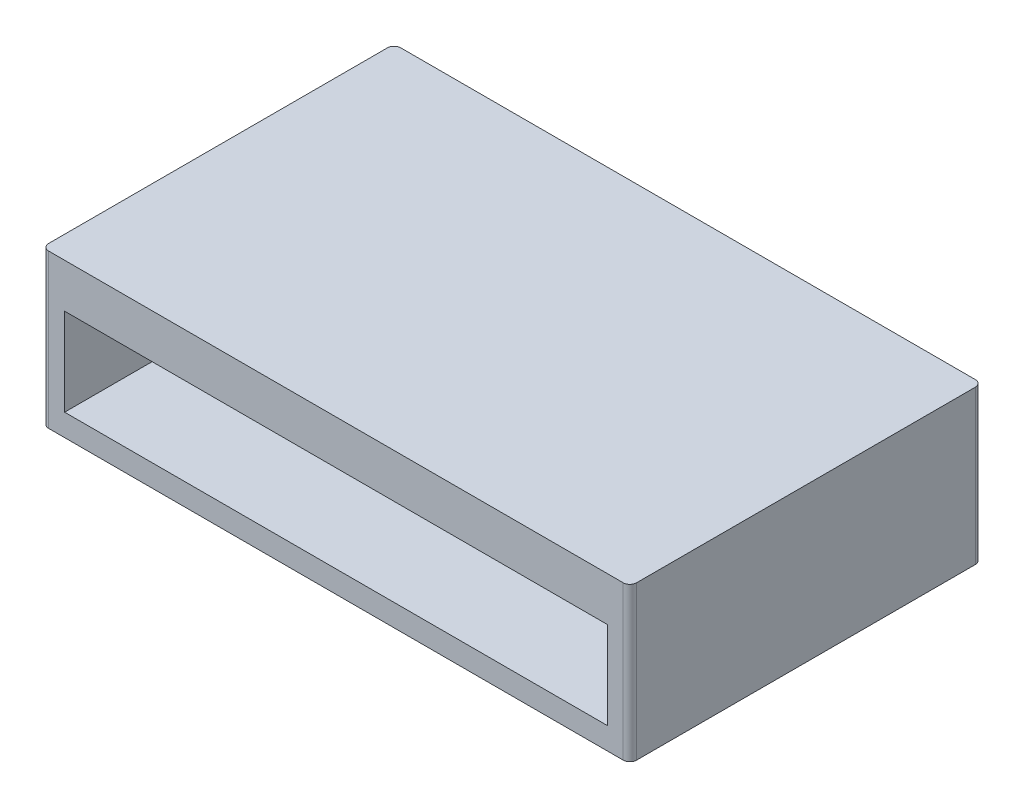
from build123d import *

# Parameters (mm, degrees)
SKETCH1_W                        = 88
SKETCH1_H                        = 52.7
BOSS_EXTRUDE1_DEPTH              = 23
SKETCH2_W                        = 81.25
SKETCH2_H                        = 13.1
CUT_EXTRUDE1_DEPTH               = 15.75
CUT_EXTRUDE2_DEPTH               = 6.5
SKETCH4_W                        = 6.69
SKETCH4_H                        = 0.8
BOSS_EXTRUDE2_DEPTH              = 6
FILLET1_R                        = 1
SKETCH6_W                        = 1.5
SKETCH6_H                        = 9
BOSS_EXTRUDE3_DEPTH              = 1
CHAMFER1_SIZE                    = 1
CHAMFER1_OF_SKETCH_PATTERN1_SIZE = 1
CUT_EXTRUDE3_DEPTH               = 4
CUT_EXTRUDE4_START               = -1.5
CUT_EXTRUDE4_DEPTH               = 2.5


with BuildPart() as part:
    # Sketch1 → Boss-Extrude1 (new body)
    with BuildSketch(Plane(origin=(0, 0, 0), x_dir=(1, 0, 0), z_dir=(0, 1, 0))):
        with Locations((44, 26.35)):
            Rectangle(SKETCH1_W, SKETCH1_H)
    extrude(amount=BOSS_EXTRUDE1_DEPTH)

    # Sketch2 → Cut-Extrude1 (cut)
    with BuildSketch(Plane.XY):
        with Locations((44, 9.85)):
            Rectangle(SKETCH2_W, SKETCH2_H)
    extrude(amount=-CUT_EXTRUDE1_DEPTH, mode=Mode.SUBTRACT)

    # Sketch3 → Cut-Extrude2 (cut)
    with BuildSketch(Plane.ZY):
        with BuildLine():
            ThreePointArc((-40.09, 17.28), (-41.37, 16), (-40.09, 14.72))
            Line((-40.09, 14.72), (-40.09, 17.28))
        make_face()
        with BuildLine():
            Line((-40.09, 17.28), (-40.09, 14.72))
            ThreePointArc((-40.09, 14.72), (-39.18490332, 15.09490332), (-38.81, 16))
            ThreePointArc((-38.81, 16), (-39.18490332, 16.90509668), (-40.09, 17.28))
        make_face()
        with BuildLine():
            ThreePointArc((-38.81, 16), (-39.18490332, 15.09490332), (-40.09, 14.72))
            Line((-40.09, 14.72), (-34.31, 14.72))
            ThreePointArc((-34.31, 14.72), (-35.59, 16), (-34.31, 17.28))
            Line((-34.31, 17.28), (-40.09, 17.28))
            ThreePointArc((-40.09, 17.28), (-39.18490332, 16.90509668), (-38.81, 16))
        make_face()
        with BuildLine():
            ThreePointArc((-34.31, 17.28), (-35.59, 16), (-34.31, 14.72))
            Line((-34.31, 14.72), (-34.31, 17.28))
        make_face()
        with BuildLine():
            Line((-34.31, 17.28), (-34.31, 14.72))
            ThreePointArc((-34.31, 14.72), (-33.40490332, 15.09490332), (-33.03, 16))
            ThreePointArc((-33.03, 16), (-33.40490332, 16.90509668), (-34.31, 17.28))
        make_face()
    extrude(amount=-CUT_EXTRUDE2_DEPTH, mode=Mode.SUBTRACT)

    # Sketch4 → Boss-Extrude2 (add)
    with BuildSketch(Plane.ZY.offset(-6.5)):
        with Locations((-37.2, 16)):
            Rectangle(SKETCH4_W, SKETCH4_H)
    extrude(amount=BOSS_EXTRUDE2_DEPTH)

    # Fillet1
    fillet1_edges = [part.edges().sort_by_distance(p)[0] for p in [
        (0, 11.5, -52.7),
        (88, 11.5, -52.7),
        (88, 11.5, 0),
        (0, 11.5, 0),
    ]]
    fillet(fillet1_edges, radius=FILLET1_R)

    # Sketch6 → Boss-Extrude3 (add)
    with BuildSketch(Plane.XZ):
        with Locations((3.75, -8.6)):
            Rectangle(SKETCH6_W, SKETCH6_H)
    boss_extrude3 = extrude(amount=BOSS_EXTRUDE3_DEPTH)

    # Chamfer1
    chamfer1_edges = [part.edges().sort_by_distance(p)[0] for p in [
        (3.75, -1, -4.1),
        (3.75, -1, -13.1),
    ]]
    chamfer(chamfer1_edges, length=CHAMFER1_SIZE - 0.0001)  # a hair under: the kernel refuses the full size

    # Sketch-Pattern1: Boss-Extrude3 at 3 more places
    with Locations((0, 0, -35.5), (80.5, 0, -35.5), (80.5, 0, 0)):
        add(boss_extrude3)

    # Chamfer1 of Sketch-Pattern1
    chamfer1_of_sketch_pattern1_edges = [part.edges().sort_by_distance(p)[0] for p in [
        (3.75, -1, -39.6),
        (3.75, -1, -48.6),
        (84.25, -1, -39.6),
        (84.25, -1, -48.6),
        (84.25, -1, -4.1),
        (84.25, -1, -13.1),
    ]]
    chamfer(chamfer1_of_sketch_pattern1_edges, length=CHAMFER1_OF_SKETCH_PATTERN1_SIZE - 0.0001)  # a hair under: the kernel refuses the full size

    # Sketch9 → Cut-Extrude3 (cut)
    with BuildSketch(Plane.XZ):
        with BuildLine():
            Line((11.75, -21.767424305), (11.75, -30.932575695))
            ThreePointArc((11.75, -30.932575695), (13.933300133, -29.088612788), (14.75, -26.35))
            ThreePointArc((14.75, -26.35), (13.933300133, -23.611387212), (11.75, -21.767424305))
        make_face()
        with BuildLine():
            Line((7.75, -21.767424305), (7.75, -30.932575695))
            ThreePointArc((7.75, -30.932575695), (9.75, -31.35), (11.75, -30.932575695))
            Line((11.75, -30.932575695), (11.75, -21.767424305))
            ThreePointArc((11.75, -21.767424305), (9.75, -21.35), (7.75, -21.767424305))
        make_face()
        with BuildLine():
            ThreePointArc((4.75, -26.35), (5.566699867, -29.088612788), (7.75, -30.932575695))
            Line((7.75, -30.932575695), (7.75, -21.767424305))
            ThreePointArc((7.75, -21.767424305), (5.566699867, -23.611387212), (4.75, -26.35))
        make_face()
        with BuildLine():
            Line((7.75, -20.85), (7.75, -21.767424305))
            ThreePointArc((7.75, -21.767424305), (9.75, -21.35), (11.75, -21.767424305))
            Line((11.75, -21.767424305), (11.75, -20.85))
            ThreePointArc((11.75, -20.85), (9.75, -18.85), (7.75, -20.85))
        make_face()
        with BuildLine():
            Line((7.75, -30.932575695), (7.75, -31.85))
            ThreePointArc((7.75, -31.85), (9.75, -33.85), (11.75, -31.85))
            Line((11.75, -31.85), (11.75, -30.932575695))
            ThreePointArc((11.75, -30.932575695), (9.75, -31.35), (7.75, -30.932575695))
        make_face()
    cut_extrude3 = extrude(amount=-CUT_EXTRUDE3_DEPTH, mode=Mode.SUBTRACT)

    # Sketch9<3> → Cut-Extrude4 (cut)
    with BuildSketch(Plane.XZ.offset(CUT_EXTRUDE4_START)):
        with BuildLine():
            ThreePointArc((11.75, -31.85), (9.75, -33.85), (7.75, -31.85))
            Line((7.75, -31.85), (7.75, -30.932575695))
            ThreePointArc((7.75, -30.932575695), (5.566699867, -29.088612788), (4.75, -26.35))
            Line((4.75, -26.35), (4.75, -31.85))
            ThreePointArc((4.75, -31.85), (9.75, -36.85), (14.75, -31.85))
            Line((14.75, -31.85), (14.75, -26.35))
            ThreePointArc((14.75, -26.35), (13.933300133, -29.088612788), (11.75, -30.932575695))
            Line((11.75, -30.932575695), (11.75, -31.85))
        make_face()
        with BuildLine():
            ThreePointArc((4.75, -26.35), (5.566699867, -23.611387212), (7.75, -21.767424305))
            Line((7.75, -21.767424305), (7.75, -20.85))
            ThreePointArc((7.75, -20.85), (9.75, -18.85), (11.75, -20.85))
            Line((11.75, -20.85), (11.75, -21.767424305))
            ThreePointArc((11.75, -21.767424305), (13.933300133, -23.611387212), (14.75, -26.35))
            Line((14.75, -26.35), (14.75, -20.85))
            ThreePointArc((14.75, -20.85), (9.75, -15.85), (4.75, -20.85))
            Line((4.75, -20.85), (4.75, -26.35))
        make_face()
    cut_extrude4 = extrude(amount=-CUT_EXTRUDE4_DEPTH, mode=Mode.SUBTRACT)

    # Sketch-Pattern2: Cut-Extrude3, Cut-Extrude4 at 1 more place
    with Locations((68.5, 0, 0)):
        add(cut_extrude3, mode=Mode.SUBTRACT)
        add(cut_extrude4, mode=Mode.SUBTRACT)


solid = part.part
